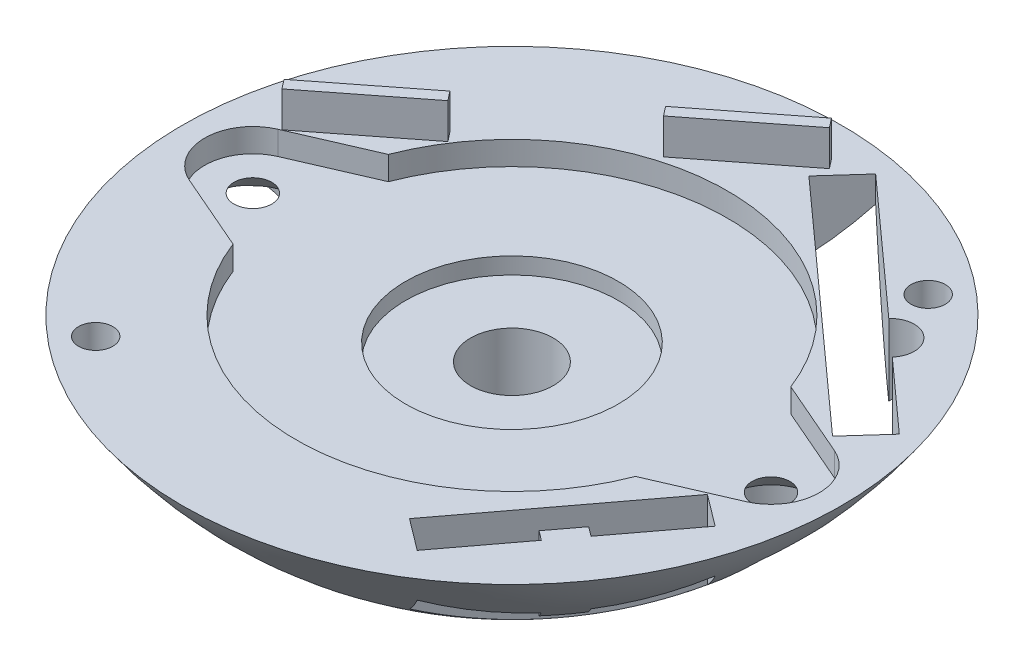
from build123d import *

# Parameters (mm, degrees)
SKETCH2_R               = 33.8
CUT_EXTRUDE1_DEPTH      = 19.1
CUT_EXTRUDE2_START      = -19.1
CUT_EXTRUDE2_DEPTH      = 2
CUT_EXTRUDE3_REACH      = 43.431
CUT_EXTRUDE3_END_RADIUS = 33.8
SKETCH6_R               = 1.6
CUT_EXTRUDE4_REACH      = 45.431
CUT_EXTRUDE4_START      = -2
SKETCH7_R               = 4.08
SKETCH8_R               = 9
CUT_EXTRUDE5_DEPTH      = 1.4
CUT_EXTRUDE6_REACH      = 43.024
CUT_EXTRUDE6_END_RADIUS = 33.8
SKETCH9_R               = 3.5
CUT_EXTRUDE8_REACH      = 44.024
CUT_EXTRUDE8_END_RADIUS = 33.8
SKETCH11_R              = 2
CUT_EXTRUDE9_REACH      = 44.024
CUT_EXTRUDE9_END_RADIUS = 33.8
CUT_EXTRUDE7_REACH      = 44.024
CUT_EXTRUDE7_END_RADIUS = 33.8
SKETCH10_R              = 1.45
BOSS_EXTRUDE1_DEPTH     = 3
CHAMFER1_SIZE           = 2


with BuildPart() as part:
    # Sketch1 → Revolve1 (revolve)
    with BuildSketch(Plane.XY, mode=Mode.PRIVATE) as revolve1_sk:
        with BuildLine():
            Line((0, -33.8), (0, 0))
            Line((0, 0), (33.8, 0))
            ThreePointArc((33.8, 0), (23.900209204, -23.900209204), (0, -33.8))
        make_face()
    revolve(revolve1_sk.sketch.rotate(Axis((0, -33.8, 0), (0, 1, 0)), 180), axis=Axis((0, -33.8, 0), (0, 1, 0)))

    # Sketch2 → Cut-Extrude1 (cut)
    with BuildSketch(Plane(origin=(0, 0, 0), x_dir=(1, 0, 0), z_dir=(0, 1, 0))):
        Circle(SKETCH2_R)
    extrude(amount=-CUT_EXTRUDE1_DEPTH, mode=Mode.SUBTRACT)

    # Sketch5 → Cut-Extrude2 (cut)
    with BuildSketch(Plane(origin=(0, 0, 0), x_dir=(1, 0, 0), z_dir=(0, 1, 0)).offset(CUT_EXTRUDE2_START)):
        with BuildLine():
            Line((-17.025732229, 6.571677263), (-23.544283672, 3.742739979))
            ThreePointArc((-23.544283672, 3.742739979), (-26, 0), (-23.544283672, -3.742739979))
            Line((-23.544283672, -3.742739979), (-17.025732229, -6.571677263))
            ThreePointArc((-17.025732229, -6.571677263), (0, -18.25), (17.025732229, -6.571677263))
            Line((17.025732229, -6.571677263), (23.544283672, -3.742739979))
            ThreePointArc((23.544283672, -3.742739979), (26, 0), (23.544283672, 3.742739979))
            Line((23.544283672, 3.742739979), (17.025732229, 6.571677263))
            ThreePointArc((17.025732229, 6.571677263), (0, 18.25), (-17.025732229, 6.571677263))
        make_face()
    extrude(amount=-CUT_EXTRUDE2_DEPTH, mode=Mode.SUBTRACT)

    # Cut-Extrude3: up to this sphere (the profile starts inside it)
    cut_extrude3_end = Location((0, 0, 0)) * Sphere(CUT_EXTRUDE3_END_RADIUS, mode=Mode.PRIVATE)
    # Sketch6 → Cut-Extrude3 (cut, up to the surface)
    with BuildSketch(Plane(origin=(0, -21.1, 0), x_dir=(1, 0, 0), z_dir=(0, 1, 0)), mode=Mode.PRIVATE) as cut_extrude3_sk1:
        with Locations(Location((-21.92, 0, 0), (0, 0, 270))):
            Circle(SKETCH6_R)
    cut_extrude3_tool1 = extrude(cut_extrude3_sk1.sketch, amount=-CUT_EXTRUDE3_REACH, mode=Mode.PRIVATE) & cut_extrude3_end
    add(cut_extrude3_tool1.solids().sort_by_distance((-21.92, -21.1, 0))[0], mode=Mode.SUBTRACT)
    # Sketch6 → Cut-Extrude3 (cut, up to the surface)
    with BuildSketch(Plane(origin=(0, -21.1, 0), x_dir=(1, 0, 0), z_dir=(0, 1, 0)), mode=Mode.PRIVATE) as cut_extrude3_sk2:
        with Locations(Location((21.92, 0, 0), (0, 0, 270))):
            Circle(SKETCH6_R)
    cut_extrude3_tool2 = extrude(cut_extrude3_sk2.sketch, amount=-CUT_EXTRUDE3_REACH, mode=Mode.PRIVATE) & cut_extrude3_end
    add(cut_extrude3_tool2.solids().sort_by_distance((21.92, -21.1, 0))[0], mode=Mode.SUBTRACT)

    # Sketch7 → Cut-Extrude4 (cut, up to next)
    with BuildSketch(Plane(origin=(0, -21.1, 0), x_dir=(1, 0, 0), z_dir=(0, 1, 0)).offset(CUT_EXTRUDE4_START), mode=Mode.PRIVATE) as cut_extrude4_sk1:
        with Locations((-21.92, 0)):
            Circle(SKETCH7_R)
    cut_extrude4_tool1 = extrude(cut_extrude4_sk1.sketch, amount=-CUT_EXTRUDE4_REACH, mode=Mode.PRIVATE) & part.part
    # Sketch7 → Cut-Extrude4 (cut, up to next)
    with BuildSketch(Plane(origin=(0, -21.1, 0), x_dir=(1, 0, 0), z_dir=(0, 1, 0)).offset(CUT_EXTRUDE4_START), mode=Mode.PRIVATE) as cut_extrude4_sk2:
        with Locations((21.92, 0)):
            Circle(SKETCH7_R)
    cut_extrude4_tool2 = extrude(cut_extrude4_sk2.sketch, amount=-CUT_EXTRUDE4_REACH, mode=Mode.PRIVATE) & part.part
    add(cut_extrude4_tool1.solids().sort_by_distance((-21.92, -23.1, 0))[0], mode=Mode.SUBTRACT)
    add(cut_extrude4_tool2.solids().sort_by_distance((21.92, -23.1, 0))[0], mode=Mode.SUBTRACT)

    # Sketch8 → Cut-Extrude5 (cut)
    with BuildSketch(Plane(origin=(0, -21.1, 0), x_dir=(1, 0, 0), z_dir=(0, 1, 0))):
        with Locations(Location((0, 0, 0), (0, 0, 270))):
            Circle(SKETCH8_R)
    extrude(amount=-CUT_EXTRUDE5_DEPTH, mode=Mode.SUBTRACT)

    # Cut-Extrude6: up to this sphere (the profile starts inside it)
    cut_extrude6_end = Location((0, 0, 0)) * Sphere(CUT_EXTRUDE6_END_RADIUS, mode=Mode.PRIVATE)
    # Sketch9 → Cut-Extrude6 (cut, up to the surface)
    with BuildSketch(Plane(origin=(0, -22.5, 0), x_dir=(1, 0, 0), z_dir=(0, 1, 0)), mode=Mode.PRIVATE) as cut_extrude6_sk1:
        with Locations(Location((0, 0, 0), (0, 0, 270))):
            Circle(SKETCH9_R)
    cut_extrude6_tool1 = extrude(cut_extrude6_sk1.sketch, amount=-CUT_EXTRUDE6_REACH, mode=Mode.PRIVATE) & cut_extrude6_end
    add(cut_extrude6_tool1.solids().sort_by_distance((0, -22.5, 0))[0], mode=Mode.SUBTRACT)

    # Cut-Extrude8: up to this sphere (the profile starts inside it)
    cut_extrude8_end = Location((0, 0, 0)) * Sphere(CUT_EXTRUDE8_END_RADIUS, mode=Mode.PRIVATE)
    # Sketch11 → Cut-Extrude8 (cut, up to the surface)
    with BuildSketch(Plane(origin=(0, -19.1, 0), x_dir=(1, 0, 0), z_dir=(0, 1, 0)), mode=Mode.PRIVATE) as cut_extrude8_sk1:
        with BuildLine():
            ThreePointArc((16.170155881, 15.717062664), (16.31818432, 12.8925118), (19.142735183, 13.040540238))
            Line((19.142735183, 13.040540238), (16.170155881, 15.717062664))
        make_face()
    cut_extrude8_tool1 = extrude(cut_extrude8_sk1.sketch, amount=-CUT_EXTRUDE8_REACH, mode=Mode.PRIVATE) & cut_extrude8_end
    add(cut_extrude8_tool1.solids().sort_by_distance((17.08847, -19.1, -13.748001))[0], mode=Mode.SUBTRACT)
    # Sketch11 → Cut-Extrude8 (cut, up to the surface)
    with BuildSketch(Plane(origin=(0, -19.1, 0), x_dir=(1, 0, 0), z_dir=(0, 1, 0)), mode=Mode.PRIVATE) as cut_extrude8_sk2:
        with BuildLine():
            Line((16.170155881, 15.717062664), (19.142735183, 13.040540238))
            ThreePointArc((19.142735183, 13.040540238), (19.523606385, 13.662065552), (19.656445532, 14.378801451))
            ThreePointArc((19.656445532, 14.378801451), (18.373181431, 16.245962304), (16.170155881, 15.717062664))
        make_face()
    cut_extrude8_tool2 = extrude(cut_extrude8_sk2.sketch, amount=-CUT_EXTRUDE8_REACH, mode=Mode.PRIVATE) & cut_extrude8_end
    add(cut_extrude8_tool2.solids().sort_by_distance((18.224421, -19.1, -15.009602))[0], mode=Mode.SUBTRACT)
    # Sketch11 → Cut-Extrude8 (cut, up to the surface)
    with BuildSketch(Plane(origin=(0, -19.1, 0), x_dir=(1, 0, 0), z_dir=(0, 1, 0)), mode=Mode.PRIVATE) as cut_extrude8_sk3:
        with Locations((17.656445532, 14.378801451)):
            Circle(SKETCH11_R)
    cut_extrude8_tool3 = extrude(cut_extrude8_sk3.sketch, amount=-CUT_EXTRUDE8_REACH, mode=Mode.PRIVATE) & cut_extrude8_end
    add(cut_extrude8_tool3.solids().sort_by_distance((17.656446, -19.1, -14.378801))[0], mode=Mode.SUBTRACT)
    # Sketch11 → Cut-Extrude8 (cut, up to the surface)
    with BuildSketch(Plane(origin=(0, -19.1, 0), x_dir=(1, 0, 0), z_dir=(0, 1, 0)), mode=Mode.PRIVATE) as cut_extrude8_sk4:
        Polygon((25.087893787, 7.687495387), (5.022983499, 25.754021759), (2.346461074, 22.781442457), (22.411371362, 4.714916085), align=None)
    cut_extrude8_tool4 = extrude(cut_extrude8_sk4.sketch, amount=-CUT_EXTRUDE8_REACH, mode=Mode.PRIVATE) & cut_extrude8_end
    add(cut_extrude8_tool4.solids().sort_by_distance((13.717177, -19.1, -15.234469))[0], mode=Mode.SUBTRACT)
    # Sketch11 → Cut-Extrude8 (cut, up to the surface)
    with BuildSketch(Plane(origin=(0, -19.1, 0), x_dir=(1, 0, 0), z_dir=(0, 1, 0)), mode=Mode.PRIVATE) as cut_extrude8_sk5:
        with BuildLine():
            ThreePointArc((16.170155881, 15.717062664), (16.31818432, 12.8925118), (19.142735183, 13.040540238))
            Line((19.142735183, 13.040540238), (16.170155881, 15.717062664))
        make_face()
    cut_extrude8_tool5 = extrude(cut_extrude8_sk5.sketch, amount=-CUT_EXTRUDE8_REACH, mode=Mode.PRIVATE) & cut_extrude8_end
    add(cut_extrude8_tool5.solids().sort_by_distance((17.08847, -19.1, -13.748001))[0], mode=Mode.SUBTRACT)
    # Sketch11 → Cut-Extrude8 (cut, up to the surface)
    with BuildSketch(Plane(origin=(0, -19.1, 0), x_dir=(1, 0, 0), z_dir=(0, 1, 0)), mode=Mode.PRIVATE) as cut_extrude8_sk6:
        with BuildLine():
            Line((16.170155881, 15.717062664), (19.142735183, 13.040540238))
            ThreePointArc((19.142735183, 13.040540238), (19.523606385, 13.662065552), (19.656445532, 14.378801451))
            ThreePointArc((19.656445532, 14.378801451), (18.373181431, 16.245962304), (16.170155881, 15.717062664))
        make_face()
    cut_extrude8_tool6 = extrude(cut_extrude8_sk6.sketch, amount=-CUT_EXTRUDE8_REACH, mode=Mode.PRIVATE) & cut_extrude8_end
    add(cut_extrude8_tool6.solids().sort_by_distance((18.224421, -19.1, -15.009602))[0], mode=Mode.SUBTRACT)

    # Cut-Extrude9: up to this sphere (the profile starts inside it)
    cut_extrude9_end = Location((0, 0, 0)) * Sphere(CUT_EXTRUDE9_END_RADIUS, mode=Mode.PRIVATE)
    # Sketch13 → Cut-Extrude9 (cut, up to the surface)
    with BuildSketch(Plane(origin=(0, -19.1, 0), x_dir=(1, 0, 0), z_dir=(0, 1, 0)), mode=Mode.PRIVATE) as cut_extrude9_sk1:
        Polygon((10.556374993, -19.224020053), (13.210464636, -21.224020053), (17.724077309, -15.234253728), (16.925441799, -14.632438705), (18.730886869, -12.236532175), (19.529522379, -12.838347198), (24.043135053, -6.848580873), (21.389045409, -4.848580873), align=None)
    cut_extrude9_tool1 = extrude(cut_extrude9_sk1.sketch, amount=-CUT_EXTRUDE9_REACH, mode=Mode.PRIVATE) & cut_extrude9_end
    add(cut_extrude9_tool1.solids().sort_by_distance((17.250772, -19.1, 12.999389))[0], mode=Mode.SUBTRACT)

    # Cut-Extrude7: up to this sphere (the profile starts inside it)
    cut_extrude7_end = Location((0, 0, 0)) * Sphere(CUT_EXTRUDE7_END_RADIUS, mode=Mode.PRIVATE)
    # Sketch10 → Cut-Extrude7 (cut, up to the surface)
    with BuildSketch(Plane(origin=(0, -19.1, 0), x_dir=(1, 0, 0), z_dir=(0, 1, 0)), mode=Mode.PRIVATE) as cut_extrude7_sk1:
        with Locations(Location((-16.069690242, -19.151111078, 0), (0, 0, 270))):
            Circle(SKETCH10_R)
    cut_extrude7_tool1 = extrude(cut_extrude7_sk1.sketch, amount=-CUT_EXTRUDE7_REACH, mode=Mode.PRIVATE) & cut_extrude7_end
    add(cut_extrude7_tool1.solids().sort_by_distance((-16.06969, -19.1, 19.151111))[0], mode=Mode.SUBTRACT)
    # Sketch10 → Cut-Extrude7 (cut, up to the surface)
    with BuildSketch(Plane(origin=(0, -19.1, 0), x_dir=(1, 0, 0), z_dir=(0, 1, 0)), mode=Mode.PRIVATE) as cut_extrude7_sk2:
        with Locations(Location((16.069690242, 19.151111078, 0), (0, 0, 270))):
            Circle(SKETCH10_R)
    cut_extrude7_tool2 = extrude(cut_extrude7_sk2.sketch, amount=-CUT_EXTRUDE7_REACH, mode=Mode.PRIVATE) & cut_extrude7_end
    add(cut_extrude7_tool2.solids().sort_by_distance((16.06969, -19.1, -19.151111))[0], mode=Mode.SUBTRACT)

    # Sketch14 → Boss-Extrude1 (add)
    with BuildSketch(Plane(origin=(0, -19.1, 0), x_dir=(1, 0, 0), z_dir=(0, 1, 0))):
        Polygon((-5.819186048, 18.818103207), (2.060921488, 24.97471796), (2.676582963, 24.186707207), (-5.203524573, 18.030092453), align=None)
        Polygon((-23.943433381, 4.657889274), (-16.063325845, 10.814504028), (-15.44766437, 10.026493274), (-23.327771906, 3.869878521), align=None)
    extrude(amount=BOSS_EXTRUDE1_DEPTH)

    # Chamfer1
    # the kernel refuses this chamfer: 2 mm, written as the material it takes off along each edge
    with BuildSketch(Plane(origin=(-21.92, -23.1, 0), x_dir=(0, 0, 1), z_dir=(-1, 0, 0))) as chamfer1_piece_1:
        Polygon((1.6 + CHAMFER1_SIZE, 0), (1.6, CHAMFER1_SIZE), (1.6, 0), align=None)
    revolve(axis=Axis((-21.92, -23.1, 0), (0, 1, 0)), mode=Mode.SUBTRACT)
    with BuildSketch(Plane(origin=(21.92, -23.1, 0), x_dir=(0, 0, 1), z_dir=(-1, 0, 0))) as chamfer1_piece_2:
        Polygon((1.6 + CHAMFER1_SIZE, 0), (1.6, CHAMFER1_SIZE), (1.6, 0), align=None)
    revolve(axis=Axis((21.92, -23.1, 0), (0, 1, 0)), mode=Mode.SUBTRACT)


solid = part.part
